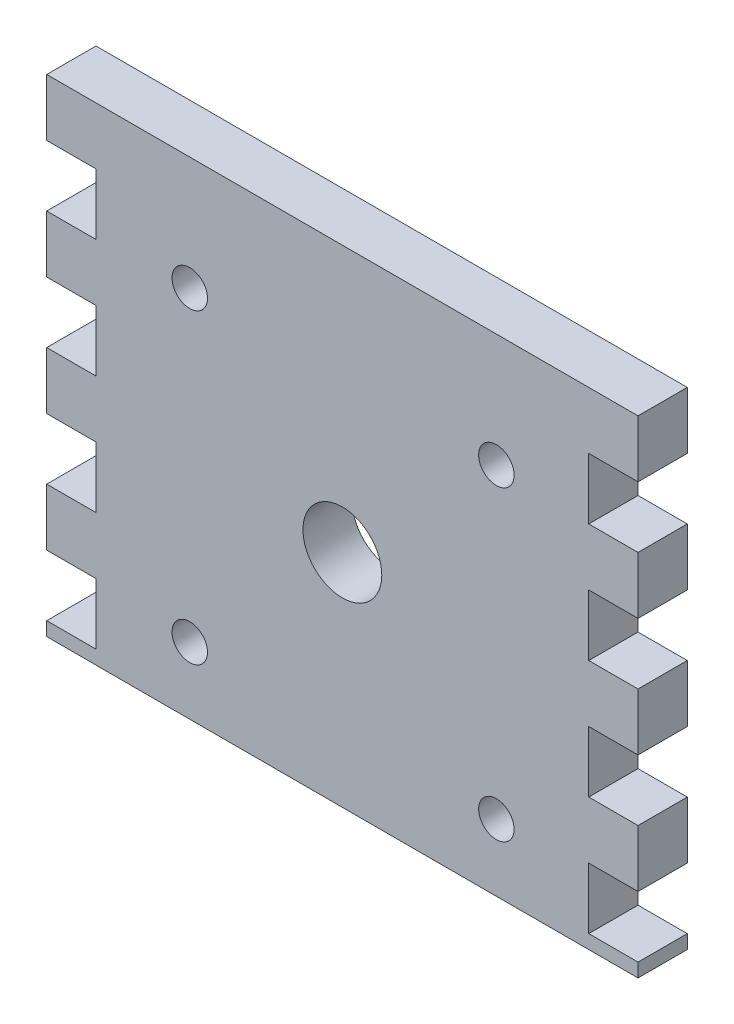
from build123d import *

# Parameters (mm, degrees)
SKETCH1_W           = 76.2
SKETCH1_H           = 76.2
BOSS_EXTRUDE1_DEPTH = 6.35
CUT_EXTRUDE1_DEPTH  = 6.35
SKETCH3_W           = 6.35
SKETCH3_H           = 38.1
CUT_EXTRUDE2_DEPTH  = 6.35
SKETCH4_W           = 6.35
SKETCH4_H           = 7.62
BOSS_EXTRUDE3_DEPTH = 6.35
SKETCH5_W           = 63.5
SKETCH5_H           = 6.35
CUT_EXTRUDE3_DEPTH  = 7.62
SKETCH6_R           = 5.08
SKETCH6_R_2         = 2.286
CUT_EXTRUDE4_DEPTH  = 71.769022866
SKETCH7_W           = 6.35
SKETCH7_H           = 7.62
BOSS_EXTRUDE4_DEPTH = 6.35
SKETCH9_W           = 63.5
SKETCH9_H           = 5.835909299
CUT_EXTRUDE5_DEPTH  = 6.35
SKETCH10_W          = 6.35
SKETCH10_H          = 6.35
BOSS_EXTRUDE5_DEPTH = 55.118
SKETCH11_W          = 6.35
SKETCH11_H          = 6.35
BOSS_EXTRUDE6_DEPTH = 55.118
CUT_EXTRUDE7_DEPTH  = 55.118


with BuildPart() as part:
    # Sketch1 → Boss-Extrude1 (new body)
    with BuildSketch(Plane.XY):
        with Locations((0.21991342, -21.056709957)):
            Rectangle(SKETCH1_W, SKETCH1_H)
    extrude(amount=BOSS_EXTRUDE1_DEPTH)

    # Sketch2 → Cut-Extrude1 (cut)
    with BuildSketch(Plane.XY.offset(6.35)):
        Polygon((-37.88008658, 17.043290043), (-31.53008658, 17.043290043), (-31.53008658, 9.423290043), (-37.88008658, 9.423290043), (-37.88008658, 1.803290043), (-31.53008658, 1.803290043), (-31.53008658, -5.816709957), (-37.88008658, -5.816709957), (-37.88008658, -13.436709957), (-31.53008658, -13.436709957), (-31.53008658, -21.056709957), (-37.88008658, -21.056709957), (-46.725849744, -21.056709957), (-46.725849744, 17.043290043), align=None)
        Polygon((47.165676584, -21.056709957), (47.165676584, 17.043290043), (38.31991342, 17.043290043), (31.96991342, 17.043290043), (31.96991342, 9.423290043), (38.31991342, 9.423290043), (38.31991342, 1.803290043), (31.96991342, 1.803290043), (31.96991342, -5.816709957), (38.31991342, -5.816709957), (38.31991342, -13.436709957), (31.96991342, -13.436709957), (31.96991342, -21.056709957), (38.31991342, -21.056709957), align=None)
    extrude(amount=-CUT_EXTRUDE1_DEPTH, mode=Mode.SUBTRACT)

    # Sketch3 → Cut-Extrude2 (cut)
    with BuildSketch(Plane.XY.offset(6.35)):
        with Locations((-34.70508658, -40.106709957)):
            Rectangle(SKETCH3_W, SKETCH3_H)
        with Locations((35.14491342, -40.106709957)):
            Rectangle(SKETCH3_W, SKETCH3_H)
    extrude(amount=-CUT_EXTRUDE2_DEPTH, mode=Mode.SUBTRACT)

    # Sketch4 → Boss-Extrude3 (add)
    with BuildSketch(Plane.XY.offset(6.35)):
        with Locations((-34.70508658, -24.866709957)):
            Rectangle(SKETCH4_W, SKETCH4_H)
        with Locations((35.14491342, -24.866709957)):
            Rectangle(SKETCH4_W, SKETCH4_H)
    extrude(amount=-BOSS_EXTRUDE3_DEPTH)

    # Sketch5 → Cut-Extrude3 (cut)
    with BuildSketch(Plane(origin=(0, 17.043290043, 0), x_dir=(1, 0, 0), z_dir=(0, 1, 0))):
        with Locations((0.21991342, -3.175)):
            Rectangle(SKETCH5_W, SKETCH5_H)
    extrude(amount=-CUT_EXTRUDE3_DEPTH, mode=Mode.SUBTRACT)

    # Sketch6 → Cut-Extrude4 (cut, through all)
    with BuildSketch(Plane.XY.offset(6.35)):
        with Locations((0.21991342, -24.866709957)):
            Circle(SKETCH6_R)
        with Locations((-19.446847485, -5.199949052)):
            Circle(SKETCH6_R_2)
        with Locations((20.066279447, -5.199949052)):
            Circle(SKETCH6_R_2)
        with Locations((20.066279447, -44.713075984)):
            Circle(SKETCH6_R_2)
        with Locations((-19.446847485, -44.713075984)):
            Circle(SKETCH6_R_2)
    extrude(amount=-CUT_EXTRUDE4_DEPTH, mode=Mode.SUBTRACT)

    # Sketch7 → Boss-Extrude4 (add)
    with BuildSketch(Plane.XY.offset(6.35)):
        with Locations((-34.70508658, -40.106709957)):
            Rectangle(SKETCH7_W, SKETCH7_H)
        with Locations((35.14491342, -40.106709957)):
            Rectangle(SKETCH7_W, SKETCH7_H)
    extrude(amount=-BOSS_EXTRUDE4_DEPTH)

    # Sketch9 → Cut-Extrude5 (cut)
    with BuildSketch(Plane.XY.offset(6.35)):
        with Locations((0.21991342, -56.238755307)):
            Rectangle(SKETCH9_W, SKETCH9_H)
    extrude(amount=-CUT_EXTRUDE5_DEPTH, mode=Mode.SUBTRACT)

    # Sketch10 → Boss-Extrude5 (add)
    with BuildSketch(Plane.XZ.offset(-1.803290043)):
        with Locations((35.14491342, 3.175)):
            Rectangle(SKETCH10_W, SKETCH10_H)
    extrude(amount=BOSS_EXTRUDE5_DEPTH)

    # Sketch11 → Boss-Extrude6 (add)
    with BuildSketch(Plane.XZ.offset(-1.803290043)):
        with Locations((-34.70508658, 3.175)):
            Rectangle(SKETCH11_W, SKETCH11_H)
    extrude(amount=BOSS_EXTRUDE6_DEPTH)

    # Sketch12 → Cut-Extrude7 (cut)
    with BuildSketch(Plane.XY.offset(6.35)):
        Polygon((-37.88008658, 2.057290043), (-37.88008658, 9.423290043), (-56.012271814, 9.423290043), (-56.012271814, -53.817588834), (-37.88008658, -51.536709957), (-31.53008658, -51.536709957), (-31.53008658, -43.662709957), (-37.88008658, -43.662709957), (-37.88008658, -36.296709957), (-31.53008658, -36.296709957), (-31.53008658, -28.422709957), (-37.88008658, -28.422709957), (-37.88008658, -21.056709957), (-31.53008658, -21.056709957), (-31.53008658, -13.182709957), (-37.88008658, -13.182709957), (-37.88008658, -5.816709957), (-31.53008658, -5.816709957), (-31.53008658, 2.057290043), align=None)
        Polygon((56.452098653, -53.817588834), (56.452098653, 9.423290043), (38.31991342, 9.423290043), (38.31991342, 2.057290043), (31.96991342, 2.057290043), (31.96991342, -5.816709957), (38.31991342, -5.816709957), (38.31991342, -13.182709957), (31.96991342, -13.182709957), (31.96991342, -21.056709957), (38.31991342, -21.056709957), (38.31991342, -28.422709957), (31.96991342, -28.422709957), (31.96991342, -36.296709957), (38.31991342, -36.296709957), (38.31991342, -43.662709957), (31.96991342, -43.662709957), (31.96991342, -51.536709957), (38.31991342, -51.536709957), align=None)
    extrude(amount=-CUT_EXTRUDE7_DEPTH, mode=Mode.SUBTRACT)


solid = part.part
